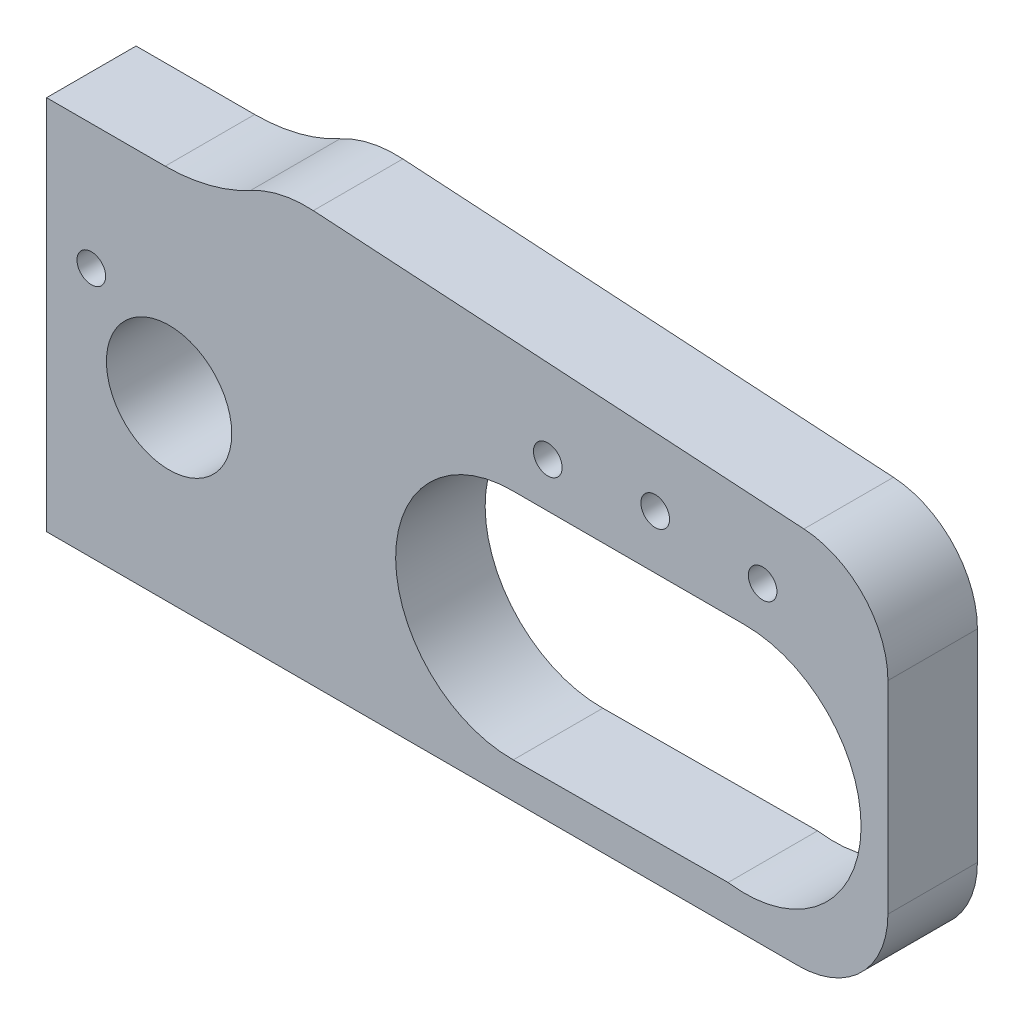
from build123d import *

# Parameters (mm, degrees)
SKETCH1_R           = 0.8
SKETCH1_R_2         = 3.5
SKETCH1_R_3         = 5.1
BOSS_EXTRUDE1_DEPTH = 5
SKETCH2_R           = 1.25
CUT_EXTRUDE1_DEPTH  = 4
BOSS_EXTRUDE2_START = -1
SKETCH21_R          = 5.1
BOSS_EXTRUDE2_DEPTH = 1


with BuildPart() as part:
    # Sketch1 → Boss-Extrude1 (new body)
    with BuildSketch(Plane(origin=(0, 0, 0), x_dir=(0, 1, 0), z_dir=(0, 0, 1))):
        with BuildLine():
            ThreePointArc((7.923715338, -23.061842121), (11.348253353, -21.704991773), (12.914157128, -18.370857874))
            Line((12.914157128, -18.370857874), (14.611258571, 9.036437401))
            ThreePointArc((14.611258571, 9.036437401), (14.470096631, 10.842810788), (13.835805455, 12.540039768))
            ThreePointArc((13.835805455, 12.540039768), (12.931450551, 14.850335933), (12.623684243, 17.312165753))
            Line((12.623684243, 17.312165753), (12.623684243, 23.938157879))
            Line((12.623684243, 23.938157879), (-8.376315757, 23.938157879))
            Line((-8.376315757, 23.938157879), (-8.376315757, -18.061842121))
            ThreePointArc((-8.376315757, -18.061842121), (-6.911849663, -21.597376027), (-3.376315757, -23.061842121))
            Line((-3.376315757, -23.061842121), (7.923715338, -23.061842121))
        make_face()
        with BuildLine():
            Line((-6.37591859, -2.133696229), (-6.376315757, -2.061842121))
            ThreePointArc((-6.376315757, -2.061842121), (0.123684243, 4.438157879), (6.623684243, -2.061842121))
            Line((6.623684243, -2.061842121), (6.623684243, -15.061842121))
            ThreePointArc((6.623684243, -15.061842121), (0.625179068, -21.542467318), (-6.298932046, -16.061842121))
            ThreePointArc((-6.298932046, -16.061842121), (-6.376216465, -15.097769724), (-6.309594086, -14.132901895))
            Line((-6.309594086, -14.132901895), (-6.37591859, -2.133696229))
        make_face(mode=Mode.SUBTRACT)
        with Locations((9.123684243, -16.061842121)):
            Circle(SKETCH1_R, mode=Mode.SUBTRACT)
        with Locations((9.623684243, -10.061842121)):
            Circle(SKETCH1_R, mode=Mode.SUBTRACT)
        with Locations((9.123684243, -4.061842121)):
            Circle(SKETCH1_R, mode=Mode.SUBTRACT)
        with Locations((1.537022692, 17.094912388)):
            Circle(SKETCH1_R_2, mode=Mode.SUBTRACT)
        with Locations((8.123684243, 9.438157879)):
            Circle(SKETCH1_R_3, mode=Mode.SUBTRACT)
        with Locations((5.623684243, 21.438157879)):
            Circle(SKETCH1_R, mode=Mode.SUBTRACT)
    extrude(amount=BOSS_EXTRUDE1_DEPTH)

    # Sketch2 → Cut-Extrude1 (cut)
    with BuildSketch(Plane(origin=(-23.938157879, 0, 0), x_dir=(0, -1, 0), z_dir=(-1, 0, 0))):
        with Locations((-9.623684243, 2.5)):
            Circle(SKETCH2_R)
        with Locations((2.876315757, 2.5)):
            Circle(SKETCH2_R)
    extrude(amount=-CUT_EXTRUDE1_DEPTH, mode=Mode.SUBTRACT)

    # Sketch21 → Boss-Extrude2 (add)
    with BuildSketch(Plane.XY.offset(5).offset(BOSS_EXTRUDE2_START)):
        with Locations((-9.438157879, 8.123684243)):
            Circle(SKETCH21_R)
    extrude(amount=BOSS_EXTRUDE2_DEPTH)


solid = part.part
